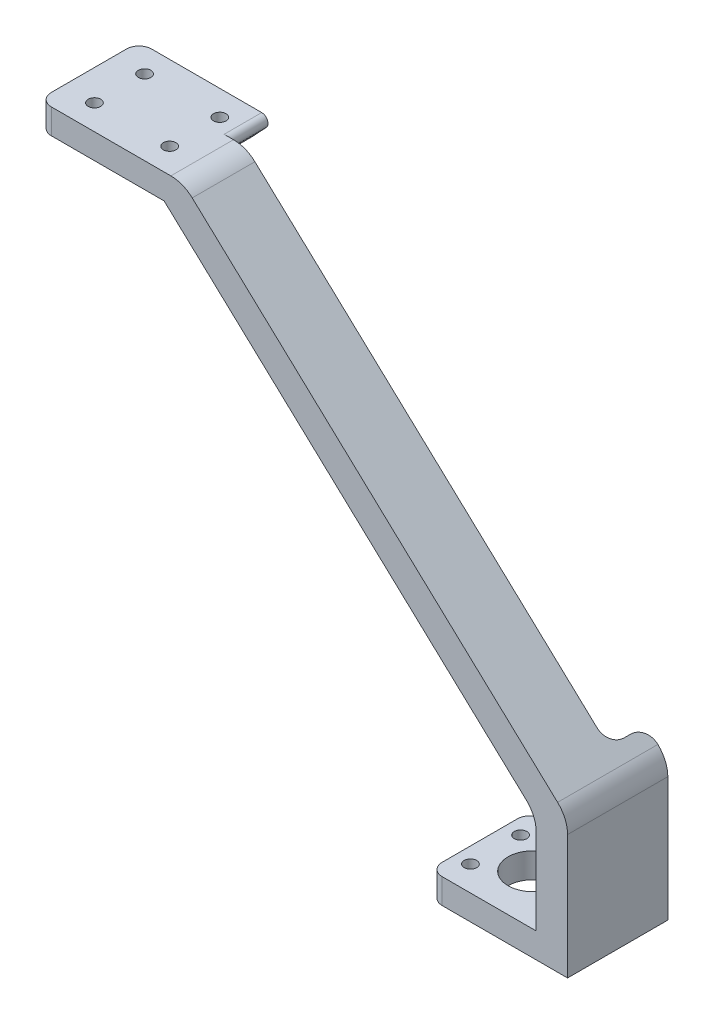
from build123d import *

# Parameters (mm, degrees)
SKETCH_1_W          = 17
SKETCH_1_H          = 16
SKETCH_1_R          = 1
SKETCH_1_R_2        = 4
EXTRUDE_1_DEPTH     = 4
EXTRUDE_2_DEPTH     = 16
SKETCH_4_R          = 1
CUT_EXTRUDE_1_DEPTH = 16
FILLET_1_R          = 2
FILLET_2_R          = 5
SKETCH_7_W          = 6
SKETCH_7_H          = 80
CUT_EXTRUDE_2_DEPTH = 10
FILLET_3_R          = 1
FILLET_4_R          = 2.5


with BuildPart() as part:
    # 草图1 → 凸台-拉伸1 (new body)
    with BuildSketch(Plane(origin=(0, 0, 0), x_dir=(1, 0, 0), z_dir=(0, 1, 0))):
        Rectangle(SKETCH_1_W, SKETCH_1_H)
        with Locations(Location((6, 4, 0), (0, 0, 270))):
            Circle(SKETCH_1_R, mode=Mode.SUBTRACT)
        with Locations(Location((-6, 4, 0), (0, 0, 90))):
            Circle(SKETCH_1_R, mode=Mode.SUBTRACT)
        with Locations(Location((6, -4, 0), (0, 0, 90))):
            Circle(SKETCH_1_R, mode=Mode.SUBTRACT)
        with Locations(Location((-6, -4, 0), (0, 0, 270))):
            Circle(SKETCH_1_R, mode=Mode.SUBTRACT)
        with Locations(Location((0, 0, 0), (0, 0, 270))):
            Circle(SKETCH_1_R_2, mode=Mode.SUBTRACT)
    extrude(amount=EXTRUDE_1_DEPTH)

    # 草图2 → 凸台-拉伸2 (add)
    with BuildSketch(Plane.XY.offset(8)):
        Polygon((8.5, 4.825938125), (8.5, 0), (13.5, 0), (13.5, 22), (-47.839490213, 79.2), (-50.691220222, 79.2), (-70.881411302, 79.2), (-70.881411302, 75.2), (-51, 75.2), (-50.881411302, 75.2), (8.5, 19.825938125), align=None)
    extrude(amount=-EXTRUDE_2_DEPTH)

    # 草图4 → 切除-拉伸1 (cut)
    with BuildSketch(Plane.XZ.offset(-75.2)):
        with Locations(Location((-54, 4, 0), (0, 0, 270))):
            Circle(SKETCH_4_R)
        with Locations(Location((-54, -4, 0), (0, 0, 270))):
            Circle(SKETCH_4_R)
        with Locations(Location((-66, -4, 0), (0, 0, 270))):
            Circle(SKETCH_4_R)
        with Locations(Location((-66, 4, 0), (0, 0, 270))):
            Circle(SKETCH_4_R)
    extrude(amount=-CUT_EXTRUDE_1_DEPTH, mode=Mode.SUBTRACT)

    # 圆角1
    fillet_1_edges = [part.edges().sort_by_distance(p)[0] for p in [
        (-70.881411302, 77.2, -8),
        (-70.881411302, 77.2, 8),
        (-8.5, 2, 8),
        (-8.5, 2, -8),
    ]]
    fillet(fillet_1_edges, radius=FILLET_1_R)

    # 圆角2
    fillet_2_edges = [part.edges().sort_by_distance(p)[0] for p in [
        (8.5, 19.825938125, 0),
        (-47.839490213, 79.2, 0),
        (13.5, 22, 0),
    ]]
    fillet(fillet_2_edges, radius=FILLET_2_R)

    # 草图7 → 切除-拉伸2 (cut)
    with BuildSketch(Plane(origin=(17.252348355, 18.50087855, 0), x_dir=(0, 0, -1), z_dir=(0.6819983600624965, 0.7313537016191725, 0))):
        with Locations((5, 49.853652648)):
            Rectangle(SKETCH_7_W, SKETCH_7_H)
    extrude(amount=-CUT_EXTRUDE_2_DEPTH, mode=Mode.SUBTRACT)

    # 圆角3
    # the kernel refuses this fillet: 1 mm, written as the material it takes off along each edge
    with BuildSketch(Plane(origin=(-49.057187154, 79.143148127, -2), x_dir=(-0.9996800282081353, 0.02529508256127706, 0), z_dir=(0, 0, -1))) as fillet_3_piece_1:
        with BuildLine():
            CenterArc((2.222251386, -0.999680028), FILLET_3_R, 88.550543928, 133)
            Line((1.473880493, -1.662960516), (1.399043403, -1.729288565))
            Line((1.399043403, -1.729288565), (-0.074837089, -0.066328049))
            Line((-0.074837089, -0.066328049), (-0.012531551, 0.099211694))
            ThreePointArc((-0.012531551, 0.099211694), (0.755582446, 0.13778344), (2.250075977, 0.099968003))
            Line((2.250075977, 0.099968003), (2.247546469, 0))
        make_face()
    extrude(amount=11.618866172, mode=Mode.SUBTRACT)

    # 圆角4
    fillet_4_edges = [part.edges().sort_by_distance(p)[0] for p in [
        (8.340847116, 23.392669243, -2),
        (8.340847116, 23.392669243, -8),
    ]]
    fillet(fillet_4_edges, radius=FILLET_4_R)


solid = part.part
